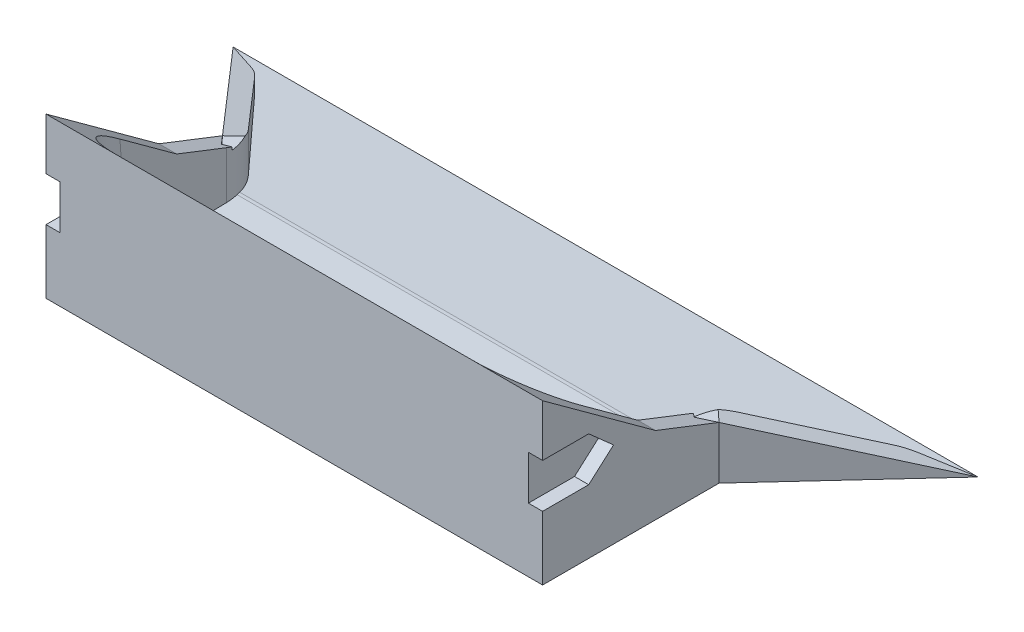
from build123d import *

# Parameters (mm, degrees)
BOSS_EXTRUDE3_DEPTH     = 45
CUT_EXTRUDE1_DEPTH      = 201.870207973
CUT_EXTRUDE1_DEPTH_BACK = 201.870207973
BOSS_EXTRUDE10_DEPTH    = 45
CUT_EXTRUDE2_DEPTH      = 201.870207973
CUT_EXTRUDE3_DEPTH      = 189.545324927
SKETCH14_W              = 5
SKETCH14_H              = 30.172848437
CUT_EXTRUDE4_DEPTH      = 5
FILLET2_R               = 15
FILLET4_R               = 10
CUT_EXTRUDE5_DEPTH      = 4


with BuildPart() as part:
    # Sketch4 → Boss-Extrude3 (new body)
    with BuildSketch(Plane(origin=(0, 0, 0), x_dir=(1, 0, 0), z_dir=(0, 1, 0))):
        Polygon((0, 49.75), (-34.996508397, 87.75), (174.996508397, 87.75), (140, 49.75), (140, 0), (0, 0), align=None)
    extrude(amount=BOSS_EXTRUDE3_DEPTH)

    # Sketch5 → Cut-Extrude1 (cut, two sides: drawn at the far end of the back side and taken through both)
    with BuildSketch(Plane(origin=(140, 0, 0), x_dir=(0, 0, -1), z_dir=(1, 0, 0)).offset(-CUT_EXTRUDE1_DEPTH_BACK)):
        Polygon((0, 45), (3, 2), (49.75, 3), (87.75, 0), (87.75, 45), align=None)
    extrude(amount=CUT_EXTRUDE1_DEPTH + CUT_EXTRUDE1_DEPTH_BACK, mode=Mode.SUBTRACT)

    # Sketch12 → Boss-Extrude10 (add)
    with BuildSketch(Plane.XZ):
        Polygon((140, 0), (135, 0), (135, -51.701623266), (161.738177617, -80.734541004), (174.996508397, -87.75), (140, -49.75), align=None)
    boss_extrude10 = extrude(amount=-BOSS_EXTRUDE10_DEPTH)

    # Sketch6 → Cut-Extrude2 (cut, symmetric)
    with BuildSketch(Plane(origin=(140, 0, 0), x_dir=(0, 0, -1), z_dir=(1, 0, 0))):
        Polygon((49.75, 45), (0, 45), (31.854288426, 21.809847033), (49.75, 14.827151563), align=None)
    cut_extrude2 = extrude(amount=CUT_EXTRUDE2_DEPTH, both=True, mode=Mode.SUBTRACT)

    # Sketch13 → Cut-Extrude3 (cut, symmetric)
    with BuildSketch(Plane(origin=(50.959743513, 0, 46.931923468), x_dir=(0.6774391869389724, 0, -0.7355787843592718), z_dir=(0.7355787843592718, 0, 0.6774391869389724))):
        Polygon((131.436530693, 14.827151563), (183.096530693, 0), (183.096530693, 45), (131.436530693, 45), align=None)
    cut_extrude3 = extrude(amount=CUT_EXTRUDE3_DEPTH, both=True, mode=Mode.SUBTRACT)

    # Sketch14 → Cut-Extrude4 (cut)
    with BuildSketch(Plane(origin=(89.040256487, 0, -96.681923468), x_dir=(-0.7355787843592717, 0, -0.6774391869389725), z_dir=(0.6774391869389725, 0, -0.7355787843592717))):
        with Locations((-66.77843026, 29.913575782)):
            Rectangle(SKETCH14_W, SKETCH14_H)
    cut_extrude4 = extrude(amount=-CUT_EXTRUDE4_DEPTH, mode=Mode.SUBTRACT)

    # Mirror1: Boss-Extrude10, Cut-Extrude2, Cut-Extrude3, Cut-Extrude4 across plane
    add(boss_extrude10.mirror(Plane(origin=(70, 0, 0), x_dir=(0, 0, 1), z_dir=(1, 0, 0))))
    add(cut_extrude2.mirror(Plane(origin=(70, 0, 0), x_dir=(0, 0, 1), z_dir=(1, 0, 0))), mode=Mode.SUBTRACT)
    add(cut_extrude3.mirror(Plane(origin=(70, 0, 0), x_dir=(0, 0, 1), z_dir=(1, 0, 0))), mode=Mode.SUBTRACT)
    add(cut_extrude4.mirror(Plane(origin=(70, 0, 0), x_dir=(0, 0, 1), z_dir=(1, 0, 0))), mode=Mode.SUBTRACT)

    # Fillet2
    # the kernel refuses this fillet: 15 mm, written as the material it adds along each edge
    with BuildSketch(Plane(origin=(5, -35.409066281, -5.609934857), x_dir=(1, 0, 0), z_dir=(0, 0.9975751008362208, 0.06959826284903867))) as fillet2_piece_1_section:
        with BuildLine():
            CenterArc((FILLET2_R, FILLET2_R), FILLET2_R, 180, 90)
            Line((0, FILLET2_R), (0, 0))
            Line((0, 0), (FILLET2_R, 0))
        make_face()
    fillet2_piece_1 = extrude(amount=118.104524125, mode=Mode.PRIVATE)
    fillet2_piece_1 = split(fillet2_piece_1, bisect_by=Plane(origin=(8.441655444, 34.86103845, -13.92700626), z_dir=(0, -0.808453521145491, 0.5885600259510132)), keep=Keep.TOP, mode=Mode.PRIVATE)
    fillet2_piece_1 = split(fillet2_piece_1, bisect_by=Plane(origin=(8.441655444, 0, -4.786685936), z_dir=(0, 1, 0)), keep=Keep.TOP, mode=Mode.PRIVATE)
    add(fillet2_piece_1)
    with BuildSketch(Plane(origin=(135, -35.409066281, -5.609934857), x_dir=(-1, 0, 0), z_dir=(0, 0.9975751008362208, 0.06959826284903867))) as fillet2_piece_2_section:
        with BuildLine():
            CenterArc((FILLET2_R, -FILLET2_R), FILLET2_R, 90, 90)
            Line((0, -FILLET2_R), (0, 0))
            Line((0, 0), (FILLET2_R, 0))
        make_face()
    fillet2_piece_2 = extrude(amount=118.104524125, mode=Mode.PRIVATE)
    fillet2_piece_2 = split(fillet2_piece_2, bisect_by=Plane(origin=(131.558344556, 34.86103845, -13.92700626), z_dir=(0, -0.808453521145491, 0.5885600259510132)), keep=Keep.TOP, mode=Mode.PRIVATE)
    fillet2_piece_2 = split(fillet2_piece_2, bisect_by=Plane(origin=(131.558344556, 0, -4.786685936), z_dir=(0, 1, 0)), keep=Keep.TOP, mode=Mode.PRIVATE)
    add(fillet2_piece_2)
    with BuildSketch(Plane(origin=(5, 2, -3), x_dir=(0, 0.9975751008362208, 0.06959826284903871), z_dir=(1, 0, 0))) as fillet2_piece_3_section:
        with BuildLine():
            CenterArc((FILLET2_R * 0.952861026227, -FILLET2_R), FILLET2_R, 90, 87.234478204)
            Line((-FILLET2_R * 0.0459743260206, -FILLET2_R * 0.951751278775), (0, 0))
            Line((0, 0), (FILLET2_R * 0.952861026227, 0))
        make_face()
    fillet2_piece_3 = extrude(amount=165.732288484, mode=Mode.PRIVATE)
    fillet2_piece_3 = split(fillet2_piece_3, bisect_by=Plane(origin=(140, 5.230522006, -5.949029167), z_dir=(-1, 0, 0)), keep=Keep.TOP, mode=Mode.PRIVATE)
    add(fillet2_piece_3)
    # the kernel refuses this fillet: 15 mm, written as the material it takes off along each edge
    with BuildSketch(Plane(origin=(-21.738177617, -5.880130796, -80.734541004), x_dir=(-0.8838887186878241, 0, -0.4676972663768696), z_dir=(0, 1, 0))) as fillet2_2_piece_1_section:
        with BuildLine():
            CenterArc((FILLET2_R * 0.171572875254, FILLET2_R), FILLET2_R, 250.528779366, 19.471220634)
            Line((-FILLET2_R * 0.16176045808, FILLET2_R * 0.0571909584179), (0, 0))
            Line((0, 0), (FILLET2_R * 0.171572875254, 0))
        make_face()
    fillet2_2_piece_1 = extrude(amount=16.37310681, mode=Mode.PRIVATE)
    fillet2_2_piece_1 = split(fillet2_2_piece_1, bisect_by=Plane(origin=(-21.810642067, 0.577757784, -80.431734736), z_dir=(0, 0.9968981486534686, -0.07870248542001068)), keep=Keep.TOP, mode=Mode.PRIVATE)
    add(fillet2_2_piece_1, mode=Mode.SUBTRACT)
    with BuildSketch(Plane(origin=(5, -11.791250012, -51.701623266), x_dir=(-0.6774391869389725, 0, -0.7355787843592716), z_dir=(0, 1, 0))) as fillet2_2_piece_2_section:
        with BuildLine():
            CenterArc((FILLET2_R * 0.390324653104, FILLET2_R), FILLET2_R, 227.356145275, 42.643854725)
            Line((-FILLET2_R * 0.287114533835, FILLET2_R * 0.264421215641), (0, 0))
            Line((0, 0), (FILLET2_R * 0.390324653104, 0))
        make_face()
    fillet2_2_piece_2 = extrude(amount=41.255576067, mode=Mode.PRIVATE)
    fillet2_2_piece_2 = split(fillet2_2_piece_2, bisect_by=Plane(origin=(4.876560205, 2.973184578, -48.496379006), z_dir=(0, 0.9997713044194101, 0.021385482447473975)), keep=Keep.TOP, mode=Mode.PRIVATE)
    add(fillet2_2_piece_2, mode=Mode.SUBTRACT)
    with BuildSketch(Plane(origin=(5, -11.791250012, -51.701623266), x_dir=(-0.6774391869389725, 0, -0.7355787843592716), z_dir=(0, 1, 0))) as fillet2_2_piece_3_section:
        with BuildLine():
            CenterArc((FILLET2_R * 0.390324653104, FILLET2_R), FILLET2_R, 227.356145275, 42.643854725)
            Line((-FILLET2_R * 0.287114533835, FILLET2_R * 0.264421215641), (0, 0))
            Line((0, 0), (FILLET2_R * 0.390324653104, 0))
        make_face()
    fillet2_2_piece_3 = extrude(amount=41.255576067, mode=Mode.PRIVATE)
    fillet2_2_piece_3 = split(fillet2_2_piece_3, bisect_by=Plane(origin=(3.697267627, 2.777037551, -52.574191023), z_dir=(0, 0.9968981486534686, -0.07870248542001068)), keep=Keep.TOP, mode=Mode.PRIVATE)
    add(fillet2_2_piece_3, mode=Mode.SUBTRACT)
    with BuildSketch(Plane(origin=(161.738177617, -5.880130796, -80.734541004), x_dir=(-0.6774391869389714, 0, 0.7355787843592727), z_dir=(0, 1, 0))) as fillet2_2_piece_4_section:
        with BuildLine():
            CenterArc((FILLET2_R * 0.171572875254, FILLET2_R), FILLET2_R, 250.528779366, 19.471220634)
            Line((-FILLET2_R * 0.16176045808, FILLET2_R * 0.0571909584179), (0, 0))
            Line((0, 0), (FILLET2_R * 0.171572875254, 0))
        make_face()
    fillet2_2_piece_4 = extrude(amount=16.37310681, mode=Mode.PRIVATE)
    fillet2_2_piece_4 = split(fillet2_2_piece_4, bisect_by=Plane(origin=(161.810642067, 0.577757784, -80.431734736), z_dir=(0, 0.9968981486534686, -0.07870248542001068)), keep=Keep.TOP, mode=Mode.PRIVATE)
    add(fillet2_2_piece_4, mode=Mode.SUBTRACT)
    with BuildSketch(Plane(origin=(135, -11.791250012, -51.701623266), x_dir=(0.6774391869389733, 0, -0.7355787843592709), z_dir=(0, 1, 0))) as fillet2_2_piece_5_section:
        with BuildLine():
            CenterArc((FILLET2_R * 0.390324653104, -FILLET2_R), FILLET2_R, 90, 42.643854725)
            Line((-FILLET2_R * 0.287114533835, -FILLET2_R * 0.264421215641), (0, 0))
            Line((0, 0), (FILLET2_R * 0.390324653104, 0))
        make_face()
    fillet2_2_piece_5 = extrude(amount=41.255576067, mode=Mode.PRIVATE)
    fillet2_2_piece_5 = split(fillet2_2_piece_5, bisect_by=Plane(origin=(135.123439795, 2.973184578, -48.496379006), z_dir=(0, 0.9997713044194101, 0.021385482447473975)), keep=Keep.TOP, mode=Mode.PRIVATE)
    add(fillet2_2_piece_5, mode=Mode.SUBTRACT)
    with BuildSketch(Plane(origin=(135, -11.791250012, -51.701623266), x_dir=(0.6774391869389733, 0, -0.7355787843592709), z_dir=(0, 1, 0))) as fillet2_2_piece_6_section:
        with BuildLine():
            CenterArc((FILLET2_R * 0.390324653104, -FILLET2_R), FILLET2_R, 90, 42.643854725)
            Line((-FILLET2_R * 0.287114533835, -FILLET2_R * 0.264421215641), (0, 0))
            Line((0, 0), (FILLET2_R * 0.390324653104, 0))
        make_face()
    fillet2_2_piece_6 = extrude(amount=41.255576067, mode=Mode.PRIVATE)
    fillet2_2_piece_6 = split(fillet2_2_piece_6, bisect_by=Plane(origin=(136.302732373, 2.777037551, -52.574191023), z_dir=(0, 0.9968981486534686, -0.07870248542001068)), keep=Keep.TOP, mode=Mode.PRIVATE)
    add(fillet2_2_piece_6, mode=Mode.SUBTRACT)

    # Fillet4
    fillet4_edges = [part.edges().sort_by_distance(p)[0] for p in [
        (70, 3, -49.75),
    ]]
    fillet(fillet4_edges, radius=FILLET4_R)

    # Sketch16 → Cut-Extrude5 (cut)
    with BuildSketch(Plane(origin=(140, 0, 0), x_dir=(0, 0, -1), z_dir=(1, 0, 0))):
        Polygon((0, 30.42), (0, 18), (13, 18), (20, 24.21), (13, 30.42), align=None)
    cut_extrude5 = extrude(amount=-CUT_EXTRUDE5_DEPTH, mode=Mode.SUBTRACT)

    # Mirror2: Cut-Extrude5 across plane
    add(cut_extrude5.mirror(Plane(origin=(70, 0, 0), x_dir=(0, 0, 1), z_dir=(1, 0, 0))), mode=Mode.SUBTRACT)


solid = part.part
